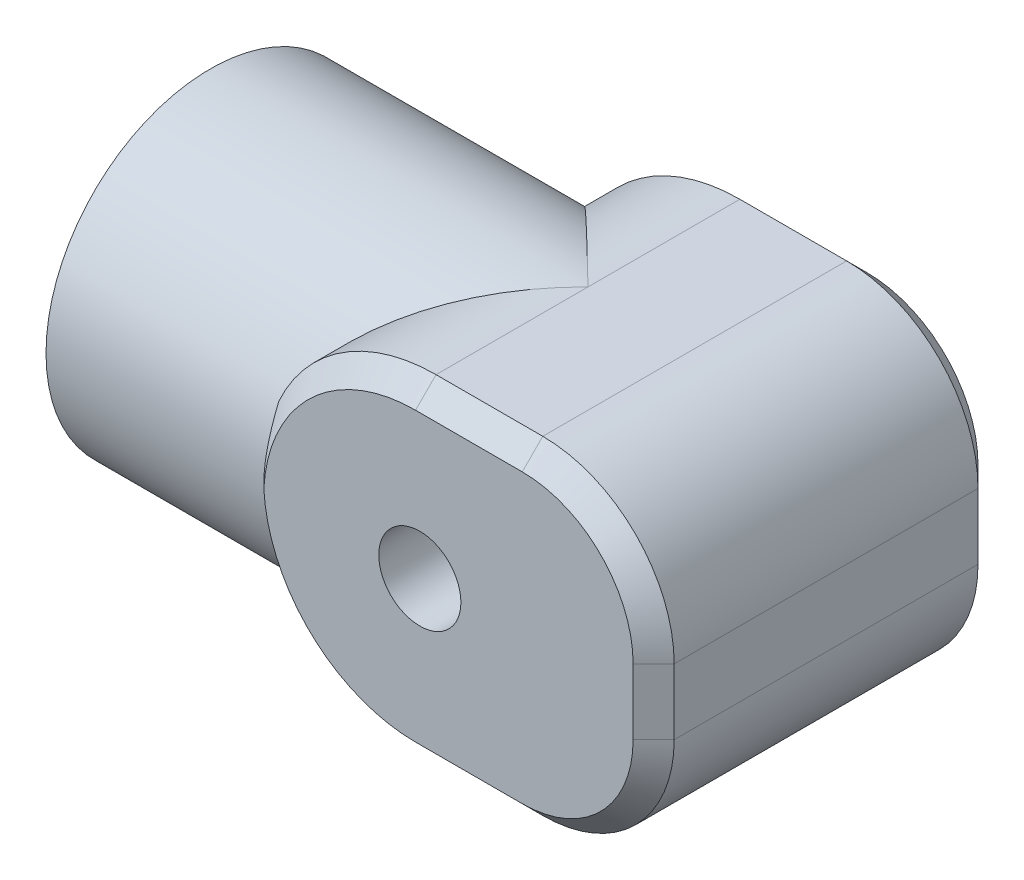
from build123d import *

# Parameters (mm, degrees)
SKETCH1_W           = 50
SKETCH1_H           = 42
BOSS_EXTRUDE1_DEPTH = 40
FILLET1_R           = 21
FILLET2_R           = 16
BOSS_EXTRUDE2_REACH = 96.81
SKETCH2_R           = 20
CHAMFER1_SIZE       = 2.5
SKETCH3_R           = 5
CUT_EXTRUDE1_DEPTH  = 10
SKETCH4_R           = 5
BOSS_EXTRUDE3_DEPTH = 10


with BuildPart() as part:
    # Sketch1 → Boss-Extrude1 (new body)
    with BuildSketch(Plane(origin=(0, 0, 0), x_dir=(1, 0, 0), z_dir=(0, 1, 0))):
        with Locations((25, 21)):
            Rectangle(SKETCH1_W, SKETCH1_H)
    extrude(amount=BOSS_EXTRUDE1_DEPTH)

    # Fillet1
    # the kernel refuses this fillet: 21 mm, written as the material it takes off along each edge
    with BuildSketch(Plane(origin=(0, 0, -94.5), x_dir=(0, 1, 0), z_dir=(0, 0, 1))) as fillet1_piece_1:
        with BuildLine():
            CenterArc((FILLET1_R, -FILLET1_R), FILLET1_R, 90, 90)
            Line((0, -FILLET1_R), (0, 0))
            Line((0, 0), (FILLET1_R, 0))
        make_face()
    extrude(amount=147, mode=Mode.SUBTRACT)
    with BuildSketch(Plane(origin=(0, 40, -94.5), x_dir=(0, -1, 0), z_dir=(0, 0, 1))) as fillet1_piece_2:
        with BuildLine():
            CenterArc((FILLET1_R, FILLET1_R), FILLET1_R, 180, 90)
            Line((0, FILLET1_R), (0, 0))
            Line((0, 0), (FILLET1_R, 0))
        make_face()
    extrude(amount=147, mode=Mode.SUBTRACT)

    # Fillet2
    fillet2_edges = [part.edges().sort_by_distance(p)[0] for p in [
        (50, 40, -21),
        (50, 0, -21),
    ]]
    fillet(fillet2_edges, radius=FILLET2_R)

    # Sketch2 → Boss-Extrude2 (add, up to next)
    with BuildSketch(Plane.ZY.offset(25), mode=Mode.PRIVATE) as boss_extrude2_sk1:
        with Locations((-21, 20)):
            Circle(SKETCH2_R)
    boss_extrude2_tool1 = extrude(boss_extrude2_sk1.sketch, amount=-BOSS_EXTRUDE2_REACH, mode=Mode.PRIVATE) - part.part
    add(boss_extrude2_tool1.solids().sort_by_distance((-25, 20, -21))[0])

    # Chamfer1
    # the kernel refuses this chamfer: 2.5 mm, written as the material it takes off along each edge
    with BuildSketch(Plane(origin=(21, 40, 0), x_dir=(0, -0.9996219169112968, 0.027495876610586334), z_dir=(1, 0, 0)), Plane(origin=(34, 0, -42), x_dir=(0, -0.027495876610586334, 0.9996219169112968), z_dir=(-1, 0, 0))) as chamfer1_piece_1:
        Polygon((CHAMFER1_SIZE * 0.999621916911, CHAMFER1_SIZE * 0.0274958766106), (-CHAMFER1_SIZE * 0.0274958766106, CHAMFER1_SIZE * 0.999621916911), (0, 0), align=None)
    extrude(amount=13, mode=Mode.SUBTRACT)
    with BuildSketch(Plane(origin=(34, 24, 0), x_dir=(1, 0, 0), z_dir=(0, -1, 0))) as chamfer1_piece_2:
        Polygon((16 - CHAMFER1_SIZE, 0), (16, -CHAMFER1_SIZE), (16, 0), align=None)
    revolve(axis=Axis((34, 24, 0), (0, 0, 1)), revolution_arc=90, mode=Mode.SUBTRACT)
    with BuildSketch(Plane(origin=(21, 19, 0), x_dir=(-0.9667409364669165, -0.25575762307127703, 0), z_dir=(0.25575762307127703, -0.9667409364669165, 0))) as chamfer1_piece_3_section:
        Polygon((21 - CHAMFER1_SIZE, 0), (21, CHAMFER1_SIZE), (21, 0), align=None)
    chamfer1_piece_3 = revolve(axis=Axis((21, 19, 0), (0, 0, -1)), revolution_arc=104.818482505, mode=Mode.PRIVATE)
    chamfer1_piece_3 = chamfer1_piece_3 - Plane(origin=(5.32298007, 20, -21), x_dir=(0, 0, 1), z_dir=(-1, 0, 0)) * Cylinder(20, 85, mode=Mode.PRIVATE)
    add(chamfer1_piece_3, mode=Mode.SUBTRACT)
    with BuildSketch(Plane(origin=(50, 16, 0), x_dir=(-0.9996219169112968, 0, 0.027495876610586334), z_dir=(0, 1, 0)), Plane(origin=(50, 16, -42), x_dir=(0.027495876610587663, 0, 0.9996219169112968), z_dir=(0, 1, 0))) as chamfer1_piece_4:
        Polygon((CHAMFER1_SIZE * 0.999621916911, -CHAMFER1_SIZE * 0.0274958766106), (-CHAMFER1_SIZE * 0.0274958766106, -CHAMFER1_SIZE * 0.999621916911), (0, 0), align=None)
    extrude(amount=8, mode=Mode.SUBTRACT)
    with BuildSketch(Plane(origin=(21, 21, 0), x_dir=(0, -1, 0), z_dir=(1, 0, 0))) as chamfer1_piece_5_section:
        Polygon((21 - CHAMFER1_SIZE, 0), (21, CHAMFER1_SIZE), (21, 0), align=None)
    chamfer1_piece_5 = revolve(axis=Axis((21, 21, 0), (0, 0, -1)), revolution_arc=104.818482505, mode=Mode.PRIVATE)
    chamfer1_piece_5 = chamfer1_piece_5 - Plane(origin=(5.322980064, 20, -21), x_dir=(0, 0, 1), z_dir=(-1, 0, 0)) * Cylinder(20, 84, mode=Mode.PRIVATE)
    add(chamfer1_piece_5, mode=Mode.SUBTRACT)
    with BuildSketch(Plane(origin=(34, 16, 0), x_dir=(0, -1, 0), z_dir=(-1, 0, 0))) as chamfer1_piece_6:
        Polygon((16 - CHAMFER1_SIZE, 0), (16, -CHAMFER1_SIZE), (16, 0), align=None)
    revolve(axis=Axis((34, 16, 0), (0, 0, 1)), revolution_arc=90, mode=Mode.SUBTRACT)
    with BuildSketch(Plane(origin=(21, 0, 0), x_dir=(0, 0.9996219169112968, 0.027495876610586372), z_dir=(1, 0, 0)), Plane(origin=(34, 40, -42), x_dir=(0, 0.027495876610587663, 0.9996219169112968), z_dir=(-1, 0, 0))) as chamfer1_piece_7:
        Polygon((CHAMFER1_SIZE * 0.999621916911, -CHAMFER1_SIZE * 0.0274958766106), (-CHAMFER1_SIZE * 0.0274958766106, -CHAMFER1_SIZE * 0.999621916911), (0, 0), align=None)
    extrude(amount=13, mode=Mode.SUBTRACT)
    with BuildSketch(Plane(origin=(34, 24, -42), x_dir=(1, 0, 0), z_dir=(0, -1, 0))) as chamfer1_piece_8:
        Polygon((16, CHAMFER1_SIZE), (16 - CHAMFER1_SIZE, 0), (16, 0), align=None)
    revolve(axis=Axis((34, 24, -42), (0, 0, 1)), revolution_arc=90, mode=Mode.SUBTRACT)
    with BuildSketch(Plane(origin=(21, 19, -42), x_dir=(-0.9667409364669164, -0.25575762307127753, 0), z_dir=(0.25575762307127753, -0.9667409364669164, 0))) as chamfer1_piece_9_section:
        Polygon((21 - CHAMFER1_SIZE, 0), (21, -CHAMFER1_SIZE), (21, 0), align=None)
    chamfer1_piece_9 = revolve(axis=Axis((21, 19, -42), (0, 0, -1)), revolution_arc=104.818482505, mode=Mode.PRIVATE)
    chamfer1_piece_9 = chamfer1_piece_9 - Plane(origin=(5.322980068, 20, -21), x_dir=(0, 0, 1), z_dir=(-1, 0, 0)) * Cylinder(20, 85, mode=Mode.PRIVATE)
    add(chamfer1_piece_9, mode=Mode.SUBTRACT)
    with BuildSketch(Plane(origin=(34, 16, -42), x_dir=(0, -1, 0), z_dir=(-1, 0, 0))) as chamfer1_piece_10:
        Polygon((16, CHAMFER1_SIZE), (16 - CHAMFER1_SIZE, 0), (16, 0), align=None)
    revolve(axis=Axis((34, 16, -42), (0, 0, 1)), revolution_arc=90, mode=Mode.SUBTRACT)
    with BuildSketch(Plane(origin=(21, 21, -42), x_dir=(0, -1, 0), z_dir=(1, 0, 0))) as chamfer1_piece_11_section:
        Polygon((21 - CHAMFER1_SIZE, 0), (21, -CHAMFER1_SIZE), (21, 0), align=None)
    chamfer1_piece_11 = revolve(axis=Axis((21, 21, -42), (0, 0, -1)), revolution_arc=104.818482505, mode=Mode.PRIVATE)
    chamfer1_piece_11 = chamfer1_piece_11 - Plane(origin=(5.322980065, 20, -21), x_dir=(0, 0, 1), z_dir=(-1, 0, 0)) * Cylinder(20, 84, mode=Mode.PRIVATE)
    add(chamfer1_piece_11, mode=Mode.SUBTRACT)

    # Sketch3 → Cut-Extrude1 (cut)
    with BuildSketch(Plane.XY):
        with Locations((21.525657906, 20)):
            Circle(SKETCH3_R)
    extrude(amount=-CUT_EXTRUDE1_DEPTH, mode=Mode.SUBTRACT)

    # Sketch4 → Boss-Extrude3 (add)
    with BuildSketch(Plane.ZY.offset(25)):
        with Locations((-21, 20)):
            Circle(SKETCH4_R)
    extrude(amount=BOSS_EXTRUDE3_DEPTH)


solid = part.part
